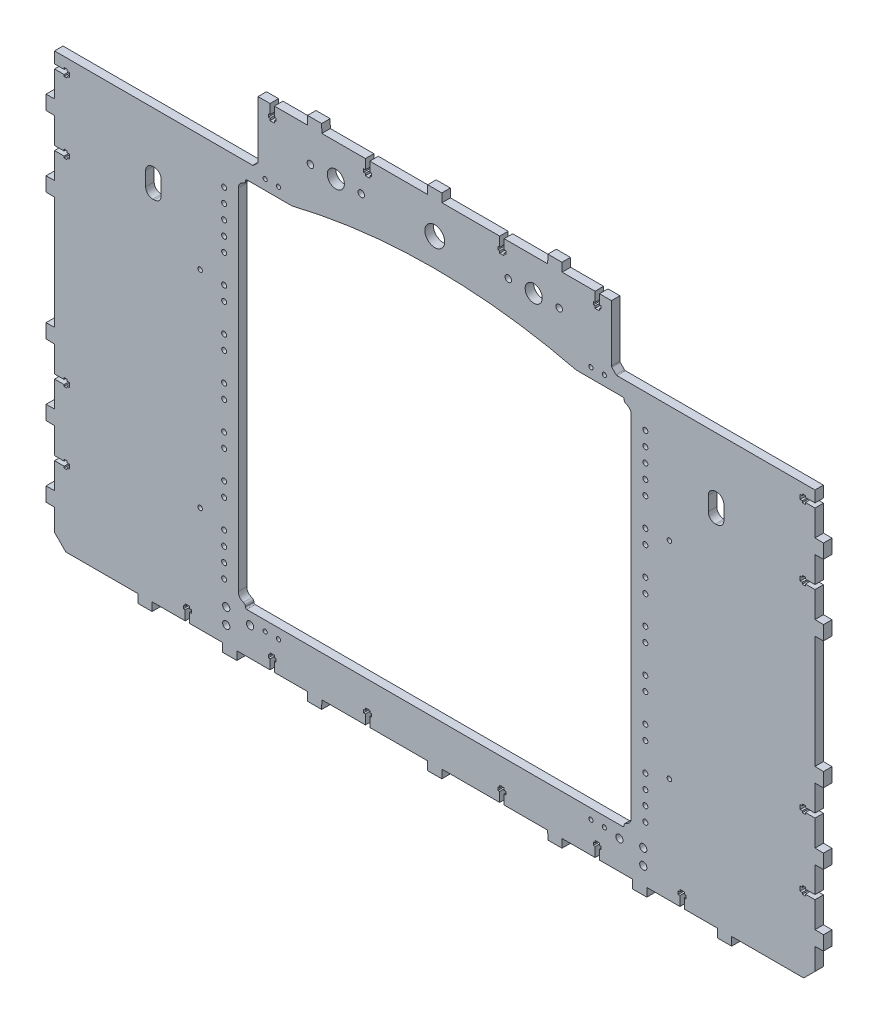
from build123d import *

# Parameters (mm, degrees)
SKETCH_1_R      = 1.6
SKETCH_1_R_2    = 1.75
SKETCH_1_R_3    = 2.55
SKETCH_1_R_4    = 1.5
SKETCH_1_R_5    = 2.3
SKETCH_1_R_6    = 6.05
SKETCH_1_R_7    = 7
EXTRUDE_1_DEPTH = 6


with BuildPart() as part:
    # Эскиз1 → Бобышка-Вытянуть1 (new body)
    with BuildSketch(Plane.XY):
        with BuildLine():
            Line((1433.580450761, 343.057239019), (1435.080450761, 343.057239019))
            Line((1435.080450761, 343.057239019), (1435.080450761, 339.95723902))
            Line((1435.080450761, 339.95723902), (1433.580450761, 339.95723902))
            Line((1433.580450761, 339.95723902), (1433.580450761, 338.75723902))
            Line((1433.580450761, 338.75723902), (1431.380450761, 338.75723902))
            Line((1431.380450761, 338.75723902), (1431.380450761, 339.95723902))
            Line((1431.380450761, 339.95723902), (1424.580450761, 339.95723902))
            Line((1424.580450761, 339.95723902), (1424.580450761, 321.60723902))
            Line((1424.580450761, 321.60723902), (1418.580450762, 321.50723902))
            Line((1418.580450762, 321.50723902), (1418.580450762, 311.50723902))
            Line((1418.580450762, 311.50723902), (1424.580450761, 311.407239019))
            Line((1424.580450761, 311.407239019), (1424.580450761, 293.05723902))
            Line((1424.580450761, 293.05723902), (1431.380450761, 293.05723902))
            Line((1431.380450761, 293.05723902), (1431.380450761, 294.25723902))
            Line((1431.380450761, 294.25723902), (1433.580450761, 294.25723902))
            Line((1433.580450761, 294.25723902), (1433.580450761, 293.05723902))
            Line((1433.580450761, 293.05723902), (1435.080450761, 293.05723902))
            Line((1435.080450761, 293.05723902), (1435.080450761, 289.95723902))
            Line((1435.080450761, 289.95723902), (1433.580450761, 289.95723902))
            Line((1433.580450761, 289.95723902), (1433.580450761, 288.75723902))
            Line((1433.580450761, 288.75723902), (1431.380450761, 288.75723902))
            Line((1431.380450761, 288.75723902), (1431.380450761, 289.95723902))
            Line((1431.380450761, 289.95723902), (1424.580450761, 289.95723902))
            Line((1424.580450761, 289.95723902), (1424.580450761, 271.60723902))
            Line((1424.580450761, 271.60723902), (1418.580450762, 271.50723902))
            Line((1418.580450762, 271.50723902), (1418.580450762, 261.50723902))
            Line((1418.580450762, 261.50723902), (1424.580450761, 261.407239019))
            Line((1424.580450761, 261.407239019), (1424.580450761, 181.60723902))
            Line((1424.580450761, 181.60723902), (1418.580450762, 181.50723902))
            Line((1418.580450762, 181.50723902), (1418.580450762, 171.50723902))
            Line((1418.580450762, 171.50723902), (1424.58045076, 171.407239019))
            Line((1424.58045076, 171.407239019), (1424.58045076, 153.05723902))
            Line((1424.58045076, 153.05723902), (1431.38045076, 153.05723902))
            Line((1431.38045076, 153.05723902), (1431.38045076, 154.257239019))
            Line((1431.38045076, 154.257239019), (1433.58045076, 154.257239019))
            Line((1433.58045076, 154.257239019), (1433.58045076, 153.057239019))
            Line((1433.58045076, 153.057239019), (1435.08045076, 153.057239019))
            Line((1435.08045076, 153.057239019), (1435.08045076, 149.957239019))
            Line((1435.08045076, 149.957239019), (1433.58045076, 149.957239019))
            Line((1433.58045076, 149.957239019), (1433.58045076, 148.757239019))
            Line((1433.58045076, 148.757239019), (1431.38045076, 148.757239019))
            Line((1431.38045076, 148.757239019), (1431.38045076, 149.957239019))
            Line((1431.38045076, 149.957239019), (1424.58045076, 149.957239019))
            Line((1424.58045076, 149.957239019), (1424.58045076, 131.607239019))
            Line((1424.58045076, 131.607239019), (1418.580450762, 131.507239019))
            Line((1418.580450762, 131.507239019), (1418.580450762, 121.507239019))
            Line((1418.580450762, 121.507239019), (1424.58045076, 121.407239018))
            Line((1424.58045076, 121.407239018), (1424.58045076, 103.057239019))
            Line((1424.58045076, 103.057239019), (1431.38045076, 103.057239019))
            Line((1431.38045076, 103.057239019), (1431.38045076, 104.257239019))
            Line((1431.38045076, 104.257239019), (1433.58045076, 104.257239019))
            Line((1433.58045076, 104.257239019), (1433.58045076, 103.057239019))
            Line((1433.58045076, 103.057239019), (1435.08045076, 103.057239019))
            Line((1435.08045076, 103.057239019), (1435.08045076, 99.957239019))
            Line((1435.08045076, 99.957239019), (1433.58045076, 99.957239019))
            Line((1433.58045076, 99.957239019), (1433.58045076, 98.757239019))
            Line((1433.58045076, 98.757239019), (1431.38045076, 98.757239019))
            Line((1431.38045076, 98.757239019), (1431.38045076, 99.957239019))
            Line((1431.38045076, 99.957239019), (1424.58045076, 99.957239019))
            Line((1424.58045076, 99.957239019), (1424.58045076, 81.607239019))
            Line((1424.58045076, 81.607239019), (1418.580450762, 81.507239019))
            Line((1418.580450762, 81.507239019), (1418.580450762, 71.507239019))
            Line((1418.580450762, 71.507239019), (1424.58045076, 71.407239018))
            Line((1424.58045076, 71.407239018), (1424.58045076, 56.007239019))
            Line((1424.58045076, 56.007239019), (1432.58045076, 48.007239019))
            Line((1432.58045076, 48.007239019), (1483.480450759, 48.007239019))
            Line((1483.480450759, 48.007239019), (1483.58045076, 42.00723902))
            Line((1483.58045076, 42.00723902), (1493.58045076, 42.00723902))
            Line((1493.58045076, 42.00723902), (1493.68045076, 48.007239019))
            Line((1493.68045076, 48.007239019), (1517.03045076, 48.007239019))
            Line((1517.03045076, 48.007239019), (1517.03045076, 54.807239019))
            Line((1517.03045076, 54.807239019), (1515.830450761, 54.807239019))
            Line((1515.830450761, 54.807239019), (1515.830450761, 57.007239019))
            Line((1515.830450761, 57.007239019), (1517.030450761, 57.007239019))
            Line((1517.030450761, 57.007239019), (1517.030450761, 58.507239019))
            Line((1517.030450761, 58.507239019), (1520.130450761, 58.507239019))
            Line((1520.130450761, 58.507239019), (1520.130450761, 57.007239019))
            Line((1520.130450761, 57.007239019), (1521.330450761, 57.007239019))
            Line((1521.330450761, 57.007239019), (1521.330450761, 54.807239019))
            Line((1521.330450761, 54.807239019), (1520.130450761, 54.807239019))
            Line((1520.130450761, 54.807239019), (1520.130450761, 48.007239019))
            Line((1520.130450761, 48.007239019), (1532.58045076, 48.007239019))
            Line((1532.58045076, 48.007239019), (1543.48045076, 48.007239019))
            Line((1543.48045076, 48.007239019), (1543.580450761, 42.00723902))
            Line((1543.580450761, 42.00723902), (1553.580450761, 42.00723902))
            Line((1553.580450761, 42.00723902), (1553.680450761, 48.007239018))
            Line((1553.680450761, 48.007239018), (1577.030450761, 48.007239018))
            Line((1577.030450761, 48.007239018), (1577.030450761, 54.807239018))
            Line((1577.030450761, 54.807239018), (1575.830450761, 54.807239018))
            Line((1575.830450761, 54.807239018), (1575.830450761, 57.007239018))
            Line((1575.830450761, 57.007239018), (1577.030450761, 57.007239018))
            Line((1577.030450761, 57.007239018), (1577.030450761, 58.507239018))
            Line((1577.030450761, 58.507239018), (1580.130450761, 58.507239018))
            Line((1580.130450761, 58.507239018), (1580.130450761, 57.007239018))
            Line((1580.130450761, 57.007239018), (1581.330450761, 57.007239018))
            Line((1581.330450761, 57.007239018), (1581.330450761, 54.807239018))
            Line((1581.330450761, 54.807239018), (1580.130450761, 54.807239018))
            Line((1580.130450761, 54.807239018), (1580.130450761, 48.007239018))
            Line((1580.130450761, 48.007239018), (1603.48045076, 48.007239018))
            Line((1603.48045076, 48.007239018), (1603.580450761, 42.007239019))
            Line((1603.580450761, 42.007239019), (1613.580450761, 42.007239019))
            Line((1613.580450761, 42.007239019), (1613.680450761, 48.007239017))
            Line((1613.680450761, 48.007239017), (1644.530450761, 48.007239017))
            Line((1644.530450761, 48.007239017), (1644.530450761, 54.807239017))
            Line((1644.530450761, 54.807239017), (1643.330450762, 54.807239017))
            Line((1643.330450762, 54.807239017), (1643.330450762, 57.007239017))
            Line((1643.330450762, 57.007239017), (1644.530450762, 57.007239017))
            Line((1644.530450762, 57.007239017), (1644.530450762, 58.507239017))
            Line((1644.530450762, 58.507239017), (1647.630450762, 58.507239017))
            Line((1647.630450762, 58.507239017), (1647.630450762, 57.007239017))
            Line((1647.630450762, 57.007239017), (1648.830450762, 57.007239017))
            Line((1648.830450762, 57.007239017), (1648.830450762, 54.807239017))
            Line((1648.830450762, 54.807239017), (1647.630450762, 54.807239017))
            Line((1647.630450762, 54.807239017), (1647.630450762, 48.007239017))
            Line((1647.630450762, 48.007239017), (1688.480450762, 48.007239017))
            Line((1688.480450762, 48.007239017), (1688.580450762, 42.007239019))
            Line((1688.580450762, 42.007239019), (1698.580450762, 42.007239019))
            Line((1698.580450762, 42.007239019), (1698.680450762, 48.007239017))
            Line((1698.680450762, 48.007239017), (1739.530450762, 48.007239017))
            Line((1739.530450762, 48.007239017), (1739.530450762, 54.807239017))
            Line((1739.530450762, 54.807239017), (1738.330450762, 54.807239017))
            Line((1738.330450762, 54.807239017), (1738.330450762, 57.007239017))
            Line((1738.330450762, 57.007239017), (1739.530450762, 57.007239017))
            Line((1739.530450762, 57.007239017), (1739.530450762, 58.507239017))
            Line((1739.530450762, 58.507239017), (1742.630450762, 58.507239017))
            Line((1742.630450762, 58.507239017), (1742.630450762, 57.007239017))
            Line((1742.630450762, 57.007239017), (1743.830450762, 57.007239017))
            Line((1743.830450762, 57.007239017), (1743.830450762, 54.807239017))
            Line((1743.830450762, 54.807239017), (1742.630450762, 54.807239017))
            Line((1742.630450762, 54.807239017), (1742.630450762, 48.007239017))
            Line((1742.630450762, 48.007239017), (1773.480450762, 48.007239017))
            Line((1773.480450762, 48.007239017), (1773.580450762, 42.007239018))
            Line((1773.580450762, 42.007239018), (1783.580450762, 42.007239018))
            Line((1783.580450762, 42.007239018), (1783.680450762, 48.007239017))
            Line((1783.680450762, 48.007239017), (1807.030450762, 48.007239017))
            Line((1807.030450762, 48.007239017), (1807.030450762, 54.807239017))
            Line((1807.030450762, 54.807239017), (1805.830450762, 54.807239017))
            Line((1805.830450762, 54.807239017), (1805.830450762, 57.007239017))
            Line((1805.830450762, 57.007239017), (1807.030450762, 57.007239017))
            Line((1807.030450762, 57.007239017), (1807.030450762, 58.507239017))
            Line((1807.030450762, 58.507239017), (1810.130450762, 58.507239017))
            Line((1810.130450762, 58.507239017), (1810.130450762, 57.007239017))
            Line((1810.130450762, 57.007239017), (1811.330450762, 57.007239017))
            Line((1811.330450762, 57.007239017), (1811.330450762, 54.807239017))
            Line((1811.330450762, 54.807239017), (1810.130450762, 54.807239017))
            Line((1810.130450762, 54.807239017), (1810.130450762, 48.007239017))
            Line((1810.130450762, 48.007239017), (1833.480450762, 48.007239017))
            Line((1833.480450762, 48.007239017), (1833.580450762, 42.007239018))
            Line((1833.580450762, 42.007239018), (1843.580450762, 42.007239018))
            Line((1843.580450762, 42.007239018), (1843.680450762, 48.007239017))
            Line((1843.680450762, 48.007239017), (1854.580450762, 48.007239017))
            Line((1854.580450762, 48.007239017), (1867.030450762, 48.007239017))
            Line((1867.030450762, 48.007239017), (1867.030450762, 54.807239017))
            Line((1867.030450762, 54.807239017), (1865.830450762, 54.807239017))
            Line((1865.830450762, 54.807239017), (1865.830450762, 57.007239017))
            Line((1865.830450762, 57.007239017), (1867.030450762, 57.007239017))
            Line((1867.030450762, 57.007239017), (1867.030450762, 58.507239017))
            Line((1867.030450762, 58.507239017), (1870.130450762, 58.507239017))
            Line((1870.130450762, 58.507239017), (1870.130450762, 57.007239017))
            Line((1870.130450762, 57.007239017), (1871.330450762, 57.007239017))
            Line((1871.330450762, 57.007239017), (1871.330450762, 54.807239017))
            Line((1871.330450762, 54.807239017), (1870.130450762, 54.807239017))
            Line((1870.130450762, 54.807239017), (1870.130450762, 48.007239017))
            Line((1870.130450762, 48.007239017), (1893.480450762, 48.007239017))
            Line((1893.480450762, 48.007239017), (1893.580450762, 42.007239018))
            Line((1893.580450762, 42.007239018), (1903.580450762, 42.007239018))
            Line((1903.580450762, 42.007239018), (1903.680450762, 48.007239017))
            Line((1903.680450762, 48.007239017), (1954.580450762, 48.007239017))
            Line((1954.580450762, 48.007239017), (1962.580450762, 56.007239017))
            Line((1962.580450762, 56.007239017), (1962.580450762, 71.407239016))
            Line((1962.580450762, 71.407239016), (1968.58045076, 71.507239016))
            Line((1968.58045076, 71.507239016), (1968.58045076, 81.507239016))
            Line((1968.58045076, 81.507239016), (1962.580450762, 81.607239016))
            Line((1962.580450762, 81.607239016), (1962.580450762, 99.957239016))
            Line((1962.580450762, 99.957239016), (1955.780450762, 99.957239016))
            Line((1955.780450762, 99.957239016), (1955.780450762, 98.757239016))
            Line((1955.780450762, 98.757239016), (1953.580450762, 98.757239016))
            Line((1953.580450762, 98.757239016), (1953.580450762, 99.957239016))
            Line((1953.580450762, 99.957239016), (1952.080450762, 99.957239016))
            Line((1952.080450762, 99.957239016), (1952.080450762, 103.057239016))
            Line((1952.080450762, 103.057239016), (1953.580450762, 103.057239016))
            Line((1953.580450762, 103.057239016), (1953.580450762, 104.257239016))
            Line((1953.580450762, 104.257239016), (1955.780450762, 104.257239016))
            Line((1955.780450762, 104.257239016), (1955.780450762, 103.057239016))
            Line((1955.780450762, 103.057239016), (1962.580450762, 103.057239016))
            Line((1962.580450762, 103.057239016), (1962.580450762, 121.407239016))
            Line((1962.580450762, 121.407239016), (1968.58045076, 121.507239016))
            Line((1968.58045076, 121.507239016), (1968.58045076, 131.507239016))
            Line((1968.58045076, 131.507239016), (1962.580450762, 131.607239016))
            Line((1962.580450762, 131.607239016), (1962.580450762, 149.957239016))
            Line((1962.580450762, 149.957239016), (1955.780450762, 149.957239016))
            Line((1955.780450762, 149.957239016), (1955.780450762, 148.757239016))
            Line((1955.780450762, 148.757239016), (1953.580450762, 148.757239016))
            Line((1953.580450762, 148.757239016), (1953.580450762, 149.957239016))
            Line((1953.580450762, 149.957239016), (1952.080450762, 149.957239016))
            Line((1952.080450762, 149.957239016), (1952.080450762, 153.057239016))
            Line((1952.080450762, 153.057239016), (1953.580450762, 153.057239016))
            Line((1953.580450762, 153.057239016), (1953.580450762, 154.257239016))
            Line((1953.580450762, 154.257239016), (1955.780450762, 154.257239016))
            Line((1955.780450762, 154.257239016), (1955.780450762, 153.057239016))
            Line((1955.780450762, 153.057239016), (1962.580450762, 153.057239016))
            Line((1962.580450762, 153.057239016), (1962.580450762, 171.407239016))
            Line((1962.580450762, 171.407239016), (1968.58045076, 171.507239016))
            Line((1968.58045076, 171.507239016), (1968.58045076, 181.507239016))
            Line((1968.58045076, 181.507239016), (1962.580450762, 181.607239016))
            Line((1962.580450762, 181.607239016), (1962.580450762, 261.407239016))
            Line((1962.580450762, 261.407239016), (1968.58045076, 261.507239017))
            Line((1968.58045076, 261.507239017), (1968.58045076, 271.507239017))
            Line((1968.58045076, 271.507239017), (1962.580450762, 271.607239017))
            Line((1962.580450762, 271.607239017), (1962.580450762, 289.957239017))
            Line((1962.580450762, 289.957239017), (1955.780450762, 289.957239017))
            Line((1955.780450762, 289.957239017), (1955.780450762, 288.757239017))
            Line((1955.780450762, 288.757239017), (1953.580450762, 288.757239017))
            Line((1953.580450762, 288.757239017), (1953.580450762, 289.957239017))
            Line((1953.580450762, 289.957239017), (1952.080450762, 289.957239017))
            Line((1952.080450762, 289.957239017), (1952.080450762, 293.057239017))
            Line((1952.080450762, 293.057239017), (1953.580450762, 293.057239017))
            Line((1953.580450762, 293.057239017), (1953.580450762, 294.257239017))
            Line((1953.580450762, 294.257239017), (1955.780450762, 294.257239017))
            Line((1955.780450762, 294.257239017), (1955.780450762, 293.057239017))
            Line((1955.780450762, 293.057239017), (1962.580450762, 293.057239017))
            Line((1962.580450762, 293.057239017), (1962.580450762, 311.407239016))
            Line((1962.580450762, 311.407239016), (1968.58045076, 311.507239017))
            Line((1968.58045076, 311.507239017), (1968.58045076, 321.507239017))
            Line((1968.58045076, 321.507239017), (1962.580450762, 321.607239017))
            Line((1962.580450762, 321.607239017), (1962.580450762, 339.957239017))
            Line((1962.580450762, 339.957239017), (1955.780450762, 339.957239017))
            Line((1955.780450762, 339.957239017), (1955.780450762, 338.757239018))
            Line((1955.780450762, 338.757239018), (1953.580450762, 338.757239018))
            Line((1953.580450762, 338.757239018), (1953.580450762, 339.957239018))
            Line((1953.580450762, 339.957239018), (1952.080450762, 339.957239018))
            Line((1952.080450762, 339.957239018), (1952.080450762, 343.057239018))
            Line((1952.080450762, 343.057239018), (1953.580450762, 343.057239018))
            Line((1953.580450762, 343.057239018), (1953.580450762, 344.257239018))
            Line((1953.580450762, 344.257239018), (1955.780450762, 344.257239018))
            Line((1955.780450762, 344.257239018), (1955.780450762, 343.057239018))
            Line((1955.780450762, 343.057239018), (1962.580450762, 343.057239018))
            Line((1962.580450762, 343.057239018), (1962.580450762, 351.007239019))
            Line((1962.580450762, 351.007239019), (1862.580450762, 351.007239019))
            Line((1862.580450762, 351.007239019), (1822.494664324, 351.007239019))
            ThreePointArc((1822.494664324, 351.007239019), (1822.111980892, 351.083359486), (1821.787557543, 351.300132238))
            Line((1821.787557543, 351.300132238), (1818.87334398, 354.2143458))
            ThreePointArc((1818.87334398, 354.2143458), (1818.656571229, 354.538769149), (1818.580450762, 354.921452581))
            Line((1818.580450762, 354.921452581), (1818.580450762, 395.007239019))
            Line((1818.580450762, 395.007239019), (1810.130450762, 395.007239019))
            Line((1810.130450762, 395.007239019), (1810.130450762, 388.207239019))
            Line((1810.130450762, 388.207239019), (1811.330450761, 388.207239019))
            Line((1811.330450761, 388.207239019), (1811.330450761, 386.007239019))
            Line((1811.330450761, 386.007239019), (1810.130450761, 386.007239019))
            Line((1810.130450761, 386.007239019), (1810.130450761, 384.507239019))
            Line((1810.130450761, 384.507239019), (1807.030450761, 384.507239019))
            Line((1807.030450761, 384.507239019), (1807.030450761, 386.007239019))
            Line((1807.030450761, 386.007239019), (1805.830450761, 386.007239019))
            Line((1805.830450761, 386.007239019), (1805.830450761, 388.207239019))
            Line((1805.830450761, 388.207239019), (1807.030450761, 388.207239019))
            Line((1807.030450761, 388.207239019), (1807.030450761, 395.007239019))
            Line((1807.030450761, 395.007239019), (1783.680450762, 395.007239019))
            Line((1783.680450762, 395.007239019), (1783.580450761, 401.007239017))
            Line((1783.580450761, 401.007239017), (1773.580450761, 401.007239017))
            Line((1773.580450761, 401.007239017), (1773.480450761, 395.007239019))
            Line((1773.480450761, 395.007239019), (1742.630450761, 395.007239019))
            Line((1742.630450761, 395.007239019), (1742.630450761, 388.207239019))
            Line((1742.630450761, 388.207239019), (1743.83045076, 388.207239019))
            Line((1743.83045076, 388.207239019), (1743.83045076, 386.007239019))
            Line((1743.83045076, 386.007239019), (1742.63045076, 386.007239019))
            Line((1742.63045076, 386.007239019), (1742.63045076, 384.507239019))
            Line((1742.63045076, 384.507239019), (1739.53045076, 384.507239019))
            Line((1739.53045076, 384.507239019), (1739.53045076, 386.007239019))
            Line((1739.53045076, 386.007239019), (1738.33045076, 386.007239019))
            Line((1738.33045076, 386.007239019), (1738.33045076, 388.207239019))
            Line((1738.33045076, 388.207239019), (1739.53045076, 388.207239019))
            Line((1739.53045076, 388.207239019), (1739.53045076, 395.007239019))
            Line((1739.53045076, 395.007239019), (1698.680450761, 395.007239019))
            Line((1698.680450761, 395.007239019), (1698.58045076, 401.007239017))
            Line((1698.58045076, 401.007239017), (1688.58045076, 401.007239017))
            Line((1688.58045076, 401.007239017), (1688.48045076, 395.007239019))
            Line((1688.48045076, 395.007239019), (1647.63045076, 395.007239019))
            Line((1647.63045076, 395.007239019), (1647.63045076, 388.207239019))
            Line((1647.63045076, 388.207239019), (1648.83045076, 388.207239019))
            Line((1648.83045076, 388.207239019), (1648.83045076, 386.007239019))
            Line((1648.83045076, 386.007239019), (1647.63045076, 386.007239019))
            Line((1647.63045076, 386.007239019), (1647.63045076, 384.507239019))
            Line((1647.63045076, 384.507239019), (1644.53045076, 384.507239019))
            Line((1644.53045076, 384.507239019), (1644.53045076, 386.007239019))
            Line((1644.53045076, 386.007239019), (1643.33045076, 386.007239019))
            Line((1643.33045076, 386.007239019), (1643.33045076, 388.207239019))
            Line((1643.33045076, 388.207239019), (1644.53045076, 388.207239019))
            Line((1644.53045076, 388.207239019), (1644.53045076, 395.007239019))
            Line((1644.53045076, 395.007239019), (1613.680450761, 395.007239019))
            Line((1613.680450761, 395.007239019), (1613.58045076, 401.007239017))
            Line((1613.58045076, 401.007239017), (1603.58045076, 401.007239017))
            Line((1603.58045076, 401.007239017), (1603.48045076, 395.007239019))
            Line((1603.48045076, 395.007239019), (1580.13045076, 395.007239019))
            Line((1580.13045076, 395.007239019), (1580.13045076, 388.207239019))
            Line((1580.13045076, 388.207239019), (1581.33045076, 388.207239019))
            Line((1581.33045076, 388.207239019), (1581.33045076, 386.007239019))
            Line((1581.33045076, 386.007239019), (1580.13045076, 386.007239019))
            Line((1580.13045076, 386.007239019), (1580.13045076, 384.507239019))
            Line((1580.13045076, 384.507239019), (1577.03045076, 384.507239019))
            Line((1577.03045076, 384.507239019), (1577.03045076, 386.007239019))
            Line((1577.03045076, 386.007239019), (1575.83045076, 386.007239019))
            Line((1575.83045076, 386.007239019), (1575.83045076, 388.207239019))
            Line((1575.83045076, 388.207239019), (1577.03045076, 388.207239019))
            Line((1577.03045076, 388.207239019), (1577.03045076, 395.007239019))
            Line((1577.03045076, 395.007239019), (1568.58045076, 395.007239019))
            Line((1568.58045076, 395.007239019), (1568.58045076, 354.921452581))
            ThreePointArc((1568.58045076, 354.921452581), (1568.504330293, 354.538769149), (1568.287557541, 354.2143458))
            Line((1568.287557541, 354.2143458), (1565.373343979, 351.300132238))
            ThreePointArc((1565.373343979, 351.300132238), (1565.04892063, 351.083359486), (1564.666237198, 351.007239019))
            Line((1564.666237198, 351.007239019), (1524.58045076, 351.007239019))
            Line((1524.58045076, 351.007239019), (1424.580450761, 351.007239019))
            Line((1424.580450761, 351.007239019), (1424.580450761, 343.057239019))
            Line((1424.580450761, 343.057239019), (1431.380450761, 343.057239019))
            Line((1431.380450761, 343.057239019), (1431.380450761, 344.257239019))
            Line((1431.380450761, 344.257239019), (1433.580450761, 344.257239019))
            Line((1433.580450761, 344.257239019), (1433.580450761, 343.057239019))
        make_face()
        with Locations((1859.58045076, 268.557239017)):
            Circle(SKETCH_1_R, mode=Mode.SUBTRACT)
        with Locations((1859.58045076, 122.557239017)):
            Circle(SKETCH_1_R, mode=Mode.SUBTRACT)
        with Locations((1527.58045076, 268.557239017)):
            Circle(SKETCH_1_R, mode=Mode.SUBTRACT)
        with Locations((1527.58045076, 122.557239017)):
            Circle(SKETCH_1_R, mode=Mode.SUBTRACT)
        with Locations((1544.58045076, 177.507239237)):
            Circle(SKETCH_1_R_2, mode=Mode.SUBTRACT)
        with Locations((1544.58045076, 147.507239237)):
            Circle(SKETCH_1_R_2, mode=Mode.SUBTRACT)
        with Locations((1544.58045076, 137.507239237)):
            Circle(SKETCH_1_R_2, mode=Mode.SUBTRACT)
        with Locations((1544.58045076, 117.507239237)):
            Circle(SKETCH_1_R_2, mode=Mode.SUBTRACT)
        with Locations((1544.58045076, 107.507239237)):
            Circle(SKETCH_1_R_2, mode=Mode.SUBTRACT)
        with Locations((1544.58045076, 97.507239237)):
            Circle(SKETCH_1_R_2, mode=Mode.SUBTRACT)
        with Locations((1544.58045076, 87.507239237)):
            Circle(SKETCH_1_R_2, mode=Mode.SUBTRACT)
        with Locations((1546.08045076, 71.007239019)):
            Circle(SKETCH_1_R_3, mode=Mode.SUBTRACT)
        with Locations((1546.08045076, 60.007239019)):
            Circle(SKETCH_1_R_3, mode=Mode.SUBTRACT)
        with Locations((1544.58045076, 197.507239237)):
            Circle(SKETCH_1_R_2, mode=Mode.SUBTRACT)
        with Locations((1544.58045076, 207.507239237)):
            Circle(SKETCH_1_R_2, mode=Mode.SUBTRACT)
        with Locations((1544.58045076, 227.507239237)):
            Circle(SKETCH_1_R_2, mode=Mode.SUBTRACT)
        with Locations((1544.58045076, 237.507239237)):
            Circle(SKETCH_1_R_2, mode=Mode.SUBTRACT)
        with Locations((1544.58045076, 257.507239237)):
            Circle(SKETCH_1_R_2, mode=Mode.SUBTRACT)
        with Locations((1544.58045076, 267.507239237)):
            Circle(SKETCH_1_R_2, mode=Mode.SUBTRACT)
        with Locations((1544.58045076, 287.507239237)):
            Circle(SKETCH_1_R_2, mode=Mode.SUBTRACT)
        with Locations((1544.58045076, 297.507239237)):
            Circle(SKETCH_1_R_2, mode=Mode.SUBTRACT)
        with Locations((1544.58045076, 307.507239237)):
            Circle(SKETCH_1_R_2, mode=Mode.SUBTRACT)
        with Locations((1544.58045076, 317.507239237)):
            Circle(SKETCH_1_R_2, mode=Mode.SUBTRACT)
        with Locations((1544.58045076, 327.507239237)):
            Circle(SKETCH_1_R_2, mode=Mode.SUBTRACT)
        with Locations((1573.58045076, 347.007239019)):
            Circle(SKETCH_1_R_4, mode=Mode.SUBTRACT)
        with Locations((1583.08045076, 347.007239019)):
            Circle(SKETCH_1_R_4, mode=Mode.SUBTRACT)
        with Locations((1605.58045076, 372.007239019)):
            Circle(SKETCH_1_R_5, mode=Mode.SUBTRACT)
        with Locations((1623.58045076, 372.007239019)):
            Circle(SKETCH_1_R_6, mode=Mode.SUBTRACT)
        with Locations((1641.58045076, 372.007239019)):
            Circle(SKETCH_1_R_5, mode=Mode.SUBTRACT)
        with Locations((1693.58045076, 372.007239019)):
            Circle(SKETCH_1_R_7, mode=Mode.SUBTRACT)
        with Locations((1745.58045076, 372.007239019)):
            Circle(SKETCH_1_R_5, mode=Mode.SUBTRACT)
        with Locations((1763.58045076, 372.007239019)):
            Circle(SKETCH_1_R_6, mode=Mode.SUBTRACT)
        with Locations((1781.58045076, 372.007239019)):
            Circle(SKETCH_1_R_5, mode=Mode.SUBTRACT)
        with Locations((1804.08045076, 347.007239019)):
            Circle(SKETCH_1_R_4, mode=Mode.SUBTRACT)
        with Locations((1813.58045076, 347.007239019)):
            Circle(SKETCH_1_R_4, mode=Mode.SUBTRACT)
        with Locations((1842.58045076, 327.507239019)):
            Circle(SKETCH_1_R_2, mode=Mode.SUBTRACT)
        with Locations((1842.58045076, 317.507239019)):
            Circle(SKETCH_1_R_2, mode=Mode.SUBTRACT)
        with Locations((1842.58045076, 307.507239019)):
            Circle(SKETCH_1_R_2, mode=Mode.SUBTRACT)
        with Locations((1842.58045076, 297.507239019)):
            Circle(SKETCH_1_R_2, mode=Mode.SUBTRACT)
        with Locations((1842.58045076, 287.507239019)):
            Circle(SKETCH_1_R_2, mode=Mode.SUBTRACT)
        with Locations((1842.58045076, 267.507239019)):
            Circle(SKETCH_1_R_2, mode=Mode.SUBTRACT)
        with Locations((1842.58045076, 257.507239019)):
            Circle(SKETCH_1_R_2, mode=Mode.SUBTRACT)
        with Locations((1842.58045076, 237.507239019)):
            Circle(SKETCH_1_R_2, mode=Mode.SUBTRACT)
        with Locations((1842.58045076, 227.507239019)):
            Circle(SKETCH_1_R_2, mode=Mode.SUBTRACT)
        with Locations((1842.58045076, 207.507239019)):
            Circle(SKETCH_1_R_2, mode=Mode.SUBTRACT)
        with Locations((1842.58045076, 197.507239019)):
            Circle(SKETCH_1_R_2, mode=Mode.SUBTRACT)
        with Locations((1842.58045076, 177.507239019)):
            Circle(SKETCH_1_R_2, mode=Mode.SUBTRACT)
        with Locations((1842.58045076, 167.507239019)):
            Circle(SKETCH_1_R_2, mode=Mode.SUBTRACT)
        with Locations((1842.58045076, 147.507239019)):
            Circle(SKETCH_1_R_2, mode=Mode.SUBTRACT)
        with Locations((1842.58045076, 137.507239019)):
            Circle(SKETCH_1_R_2, mode=Mode.SUBTRACT)
        with Locations((1842.58045076, 117.507239019)):
            Circle(SKETCH_1_R_2, mode=Mode.SUBTRACT)
        with Locations((1842.58045076, 107.507239019)):
            Circle(SKETCH_1_R_2, mode=Mode.SUBTRACT)
        with Locations((1842.58045076, 97.507239019)):
            Circle(SKETCH_1_R_2, mode=Mode.SUBTRACT)
        with Locations((1842.58045076, 87.507239019)):
            Circle(SKETCH_1_R_2, mode=Mode.SUBTRACT)
        with Locations((1841.08045076, 71.007239019)):
            Circle(SKETCH_1_R_3, mode=Mode.SUBTRACT)
        with Locations((1841.08045076, 60.007239019)):
            Circle(SKETCH_1_R_3, mode=Mode.SUBTRACT)
        with Locations((1824.227659727, 68.296772665)):
            Circle(SKETCH_1_R_3, mode=Mode.SUBTRACT)
        with Locations((1813.58045076, 69.78654025)):
            Circle(SKETCH_1_R_4, mode=Mode.SUBTRACT)
        with Locations((1804.08045076, 69.78654025)):
            Circle(SKETCH_1_R_4, mode=Mode.SUBTRACT)
        with Locations((1583.08045076, 69.78654025)):
            Circle(SKETCH_1_R_4, mode=Mode.SUBTRACT)
        with Locations((1573.58045076, 69.78654025)):
            Circle(SKETCH_1_R_4, mode=Mode.SUBTRACT)
        with Locations((1562.93045076, 68.296772665)):
            Circle(SKETCH_1_R_3, mode=Mode.SUBTRACT)
        with Locations((1544.58045076, 167.507239237)):
            Circle(SKETCH_1_R_2, mode=Mode.SUBTRACT)
        with BuildLine():
            Line((1560.58045076, 76.78654025), (1826.579713792, 76.78654025))
            ThreePointArc((1826.579713792, 76.78654025), (1827.286820573, 77.079433469), (1827.579713792, 77.78654025))
            Line((1827.579713792, 77.78654025), (1827.579713792, 78.078336318))
            ThreePointArc((1827.579713792, 78.078336318), (1827.976146341, 79.273564927), (1829.008285221, 79.994966013))
            ThreePointArc((1829.008285221, 79.994966013), (1831.588627971, 81.798462757), (1832.579713792, 84.786525358))
            Line((1832.579713792, 84.786525358), (1832.580467982, 332.007224127))
            ThreePointArc((1832.580467982, 332.007224127), (1831.589391061, 334.995304572), (1829.009039411, 336.798813256))
            ThreePointArc((1829.009039411, 336.798813256), (1827.976900531, 337.520214342), (1827.580467982, 338.715442951))
            Line((1827.580467982, 338.715442951), (1827.580467982, 339.007239019))
            ThreePointArc((1827.580467982, 339.007239019), (1827.287574764, 339.7143458), (1826.580467982, 340.007239019))
            Line((1826.580467982, 340.007239019), (1793.680450761, 340.007239019))
            ThreePointArc((1793.680450761, 340.007239019), (1693.122117427, 352.15701974), (1592.563784093, 340.007239019))
            Line((1592.563784093, 340.007239019), (1560.58045076, 340.007239019))
            ThreePointArc((1560.58045076, 340.007239019), (1559.873343979, 339.7143458), (1559.58045076, 339.007239019))
            Line((1559.58045076, 339.007239019), (1559.58045076, 338.715442951))
            ThreePointArc((1559.58045076, 338.715442951), (1559.184018212, 337.520214342), (1558.151879332, 336.798813256))
            ThreePointArc((1558.151879332, 336.798813256), (1555.571532132, 334.995310542), (1554.58045076, 332.007239019))
            Line((1554.58045076, 332.007239019), (1554.58045076, 84.78654025))
            ThreePointArc((1554.58045076, 84.78654025), (1555.571532132, 81.798468727), (1558.151879332, 79.994966012))
            ThreePointArc((1558.151879332, 79.994966012), (1559.184018212, 79.273564927), (1559.58045076, 78.078336317))
            Line((1559.58045076, 78.078336317), (1559.58045076, 77.78654025))
            ThreePointArc((1559.58045076, 77.78654025), (1559.873343979, 77.079433469), (1560.58045076, 76.78654025))
        make_face(mode=Mode.SUBTRACT)
        with BuildLine():
            Line((1892.08045076, 314.95723902), (1893.08045076, 314.95723902))
            ThreePointArc((1893.08045076, 314.95723902), (1896.615984666, 313.492772926), (1898.08045076, 309.95723902))
            Line((1898.08045076, 309.95723902), (1898.08045076, 299.95723902))
            ThreePointArc((1898.08045076, 299.95723902), (1896.615984666, 296.421705114), (1893.08045076, 294.95723902))
            Line((1893.08045076, 294.95723902), (1892.08045076, 294.95723902))
            ThreePointArc((1892.08045076, 294.95723902), (1888.544916854, 296.421705114), (1887.08045076, 299.95723902))
            Line((1887.08045076, 299.95723902), (1887.08045076, 309.95723902))
            ThreePointArc((1887.08045076, 309.95723902), (1888.544916854, 313.492772926), (1892.08045076, 314.95723902))
        make_face(mode=Mode.SUBTRACT)
        with BuildLine():
            Line((1495.08045076, 294.95723902), (1494.08045076, 294.95723902))
            ThreePointArc((1494.08045076, 294.95723902), (1490.544916854, 296.421705114), (1489.08045076, 299.95723902))
            Line((1489.08045076, 299.95723902), (1489.08045076, 309.95723902))
            ThreePointArc((1489.08045076, 309.95723902), (1490.544916854, 313.492772926), (1494.08045076, 314.95723902))
            Line((1494.08045076, 314.95723902), (1495.08045076, 314.95723902))
            ThreePointArc((1495.08045076, 314.95723902), (1498.615984666, 313.492772926), (1500.08045076, 309.95723902))
            Line((1500.08045076, 309.95723902), (1500.08045076, 299.95723902))
            ThreePointArc((1500.08045076, 299.95723902), (1498.615984666, 296.421705114), (1495.08045076, 294.95723902))
        make_face(mode=Mode.SUBTRACT)
    extrude(amount=EXTRUDE_1_DEPTH)


solid = part.part
